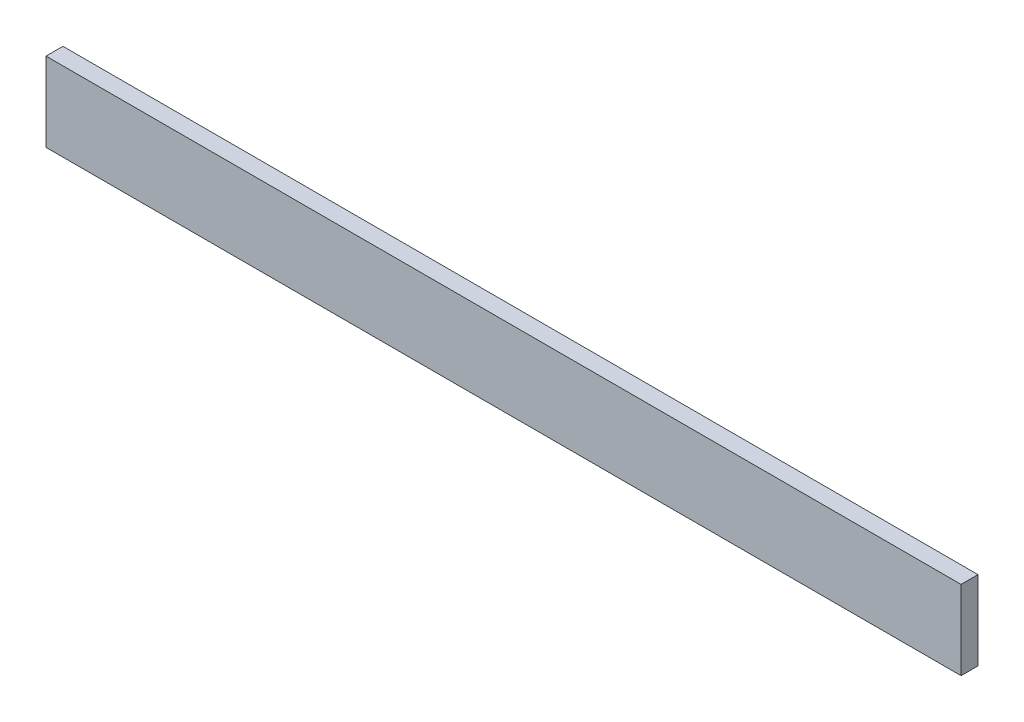
from build123d import *

# Parameters (mm, degrees)
BOSS_EXTRUDE1_DEPTH      = 514.35
BOSS_EXTRUDE1_DEPTH_BACK = 514.35
SKETCH1_W                = 19.05
SKETCH1_H                = 88.9


with BuildPart() as part:
    # Sketch1 → Boss-Extrude1 (new, two sides: drawn at the far end of the back side and taken through both)
    with BuildSketch(Plane(origin=(0, 0, 0), x_dir=(0, 0, -1), z_dir=(1, 0, 0)).offset(-BOSS_EXTRUDE1_DEPTH_BACK)):
        Rectangle(SKETCH1_W, SKETCH1_H)
    extrude(amount=BOSS_EXTRUDE1_DEPTH + BOSS_EXTRUDE1_DEPTH_BACK)


solid = part.part
